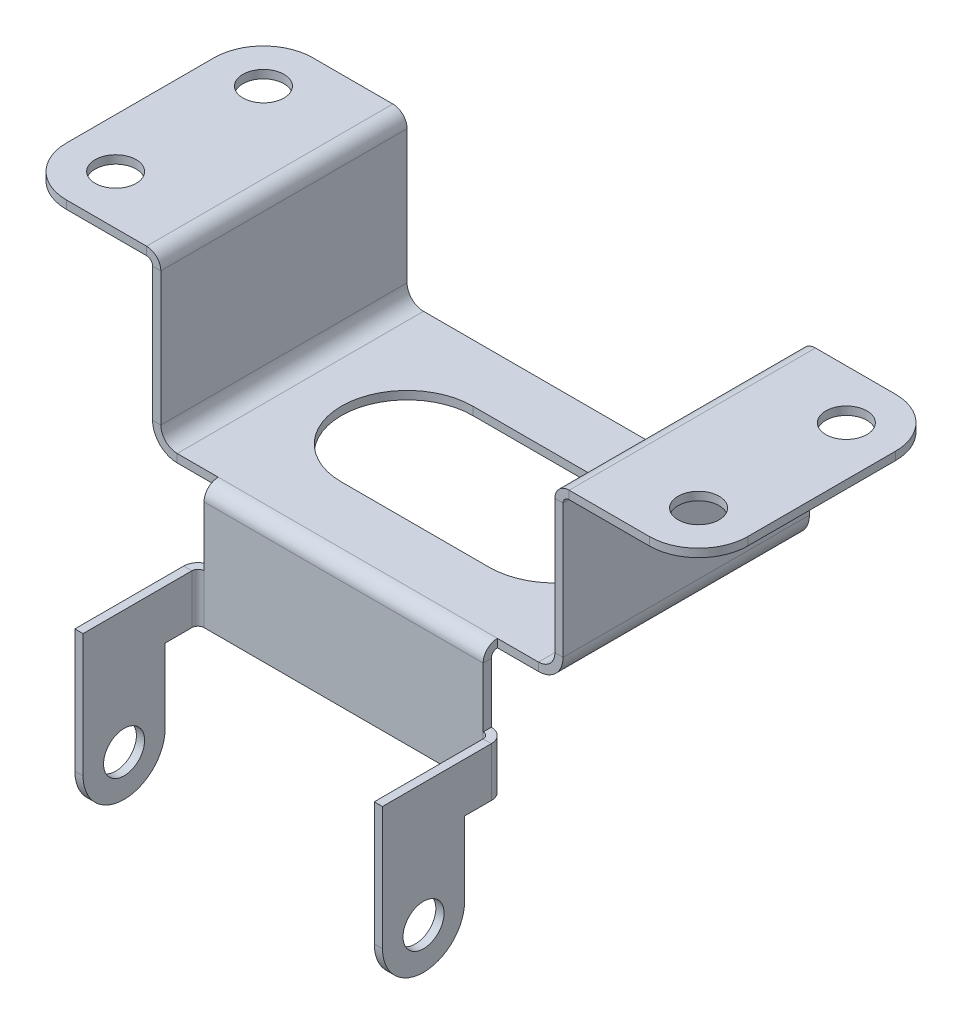
from build123d import *

# Parameters (mm, degrees)
SKETCH1_W                      = 50
SKETCH1_H                      = 30
BASE_FLANGE1_DEPTH             = 1
EDGE_FLANGE1_STRIP_W           = 8
EDGE_FLANGE1_STRIP_H           = 1
EDGE_FLANGE1_STRIP_CUT_DEPTH   = 30
EDGE_FLANGE1_STRIP_2_W         = 8
EDGE_FLANGE1_STRIP_2_H         = 1
EDGE_FLANGE1_STRIP_CUT_2_DEPTH = 30
EDGE_FLANGE1_DEPTH             = 30
EDGE_FLANGE1_BEND_DEPTH        = 30
EDGE_FLANGE2_STRIP_W           = 5.4732
EDGE_FLANGE2_STRIP_H           = 1
EDGE_FLANGE2_STRIP_CUT_DEPTH   = 30
EDGE_FLANGE2_STRIP_2_W         = 5.4732
EDGE_FLANGE2_STRIP_2_H         = 1
EDGE_FLANGE2_STRIP_CUT_2_DEPTH = 30
EDGE_FLANGE2_DEPTH             = 30
EDGE_FLANGE2_BEND_DEPTH        = 30
BREAK_CORNER1_START            = 20
BREAK_CORNER1_DEPTH            = 1
CUT_EXTRUDE1_DEPTH             = 10
SKETCH25_R                     = 2.5
CUT_EXTRUDE2_DEPTH             = 10
EDGE_FLANGE3_DEPTH             = 34
EDGE_FLANGE4_DEPTH             = 6
EDGE_FLANGE4_START             = -1
EDGE_FLANGE4_PROFILE_R         = 2.5
EDGE_FLANGE4_FLAT_DEPTH        = 1


# Read off the part's stored shape, not the designer's step: Break-Corner1
# Sheet-metal steps are written as plain solids
with BuildPart() as part:
    # Sketch1 → Base-Flange1 (new body)
    with BuildSketch(Plane(origin=(0, 0, 0), x_dir=(1, 0, 0), z_dir=(0, 1, 0))):
        Rectangle(SKETCH1_W, SKETCH1_H)
    extrude(amount=BASE_FLANGE1_DEPTH)

    # Edge-Flange1 strip (across the edge) → Edge-Flange1 strip cut (cut)
    with BuildSketch(Plane(origin=(25, 1, 15), x_dir=(-1, 0, 0), z_dir=(0, 0, -1))):
        with Locations((-1, -0.5)):
            Rectangle(EDGE_FLANGE1_STRIP_W, EDGE_FLANGE1_STRIP_H)
    extrude(amount=EDGE_FLANGE1_STRIP_CUT_DEPTH, mode=Mode.SUBTRACT)

    # Edge-Flange1 strip 2 (across the edge) → Edge-Flange1 strip cut 2 (cut)
    with BuildSketch(Plane(origin=(-25, 1, -15), x_dir=(1, 0, 0), z_dir=(0, 0, 1))):
        with Locations((-1, -0.5)):
            Rectangle(EDGE_FLANGE1_STRIP_2_W, EDGE_FLANGE1_STRIP_2_H)
    extrude(amount=EDGE_FLANGE1_STRIP_CUT_2_DEPTH, mode=Mode.SUBTRACT)

    # Edge-Flange1 section (across the edge) → Edge-Flange1 (add)
    with BuildSketch(Plane(origin=(25, 1, 15), x_dir=(-1, 0, 0), z_dir=(0, 0, -1))):
        with BuildLine():
            Line((0, 2), (0, 19))
            Line((0, 19), (1, 19))
            Line((1, 19), (1, 2))
            ThreePointArc((1, 2), (1.585786438, 0.585786438), (3, 0))
            Line((3, 0), (3, -1))
            ThreePointArc((3, -1), (0.878679656, -0.121320344), (0, 2))
        make_face()
    extrude(amount=EDGE_FLANGE1_DEPTH)

    # Edge-Flange1 section 2 (across the edge) → Edge-Flange1 bend (add)
    with BuildSketch(Plane(origin=(-25, 1, -15), x_dir=(1, 0, 0), z_dir=(0, 0, 1))):
        with BuildLine():
            Line((0, 2), (0, 19))
            Line((0, 19), (1, 19))
            Line((1, 19), (1, 2))
            ThreePointArc((1, 2), (1.585786438, 0.585786438), (3, 0))
            Line((3, 0), (3, -1))
            ThreePointArc((3, -1), (0.878679656, -0.121320344), (0, 2))
        make_face()
    extrude(amount=EDGE_FLANGE1_BEND_DEPTH)

    # Edge-Flange2 strip (across the edge) → Edge-Flange2 strip cut (cut)
    with BuildSketch(Plane(origin=(25, 20, -15), x_dir=(0, -1, 0), z_dir=(0, 0, 1))):
        with Locations((-2, -0.5)):
            Rectangle(EDGE_FLANGE2_STRIP_W, EDGE_FLANGE2_STRIP_H)
    extrude(amount=EDGE_FLANGE2_STRIP_CUT_DEPTH, mode=Mode.SUBTRACT)

    # Edge-Flange2 strip 2 (across the edge) → Edge-Flange2 strip cut 2 (cut)
    with BuildSketch(Plane(origin=(-25, 20, 15), x_dir=(0, -1, 0), z_dir=(0, 0, -1))):
        with Locations((-2, -0.5)):
            Rectangle(EDGE_FLANGE2_STRIP_2_W, EDGE_FLANGE2_STRIP_2_H)
    extrude(amount=EDGE_FLANGE2_STRIP_CUT_2_DEPTH, mode=Mode.SUBTRACT)

    # Edge-Flange2 section (across the edge) → Edge-Flange2 (add)
    with BuildSketch(Plane(origin=(25, 20, -15), x_dir=(0, -1, 0), z_dir=(0, 0, 1))):
        with BuildLine():
            Line((-1, 0.7366), (-1, 16.5))
            Line((-1, 16.5), (0, 16.5))
            Line((0, 16.5), (0, 0.7366))
            ThreePointArc((0, 0.7366), (0.215745145, 0.215745145), (0.7366, 0))
            Line((0.7366, 0), (0.7366, -1))
            ThreePointArc((0.7366, -1), (-0.491361636, -0.491361636), (-1, 0.7366))
        make_face()
    extrude(amount=EDGE_FLANGE2_DEPTH)

    # Edge-Flange2 section 2 (across the edge) → Edge-Flange2 bend (add)
    with BuildSketch(Plane(origin=(-25, 20, 15), x_dir=(0, -1, 0), z_dir=(0, 0, -1))):
        with BuildLine():
            Line((-1, 0.7366), (-1, 16.5))
            Line((-1, 16.5), (0, 16.5))
            Line((0, 16.5), (0, 0.7366))
            ThreePointArc((0, 0.7366), (0.215745145, 0.215745145), (0.7366, 0))
            Line((0.7366, 0), (0.7366, -1))
            ThreePointArc((0.7366, -1), (-0.491361636, -0.491361636), (-1, 0.7366))
        make_face()
    extrude(amount=EDGE_FLANGE2_BEND_DEPTH)

    # Break-Corner1 outline → Break-Corner1 (cut)
    with BuildSketch(Plane(origin=(0, 0, 0), x_dir=(1, 0, 0), z_dir=(0, 1, 0)).offset(BREAK_CORNER1_START)):
        with BuildLine():
            Line((41.5, -15), (41.5, -9))
            ThreePointArc((41.5, -9), (39.742640687, -13.242640687), (35.5, -15))
            Line((35.5, -15), (41.5, -15))
        make_face()
        with BuildLine():
            ThreePointArc((35.5, 15), (39.742640687, 13.242640687), (41.5, 9))
            Line((41.5, 9), (41.5, 15))
            Line((41.5, 15), (35.5, 15))
        make_face()
        with BuildLine():
            Line((-41.5, -15), (-35.5, -15))
            ThreePointArc((-35.5, -15), (-39.742640687, -13.242640687), (-41.5, -9))
            Line((-41.5, -9), (-41.5, -15))
        make_face()
        with BuildLine():
            Line((-41.5, 15), (-41.5, 9))
            ThreePointArc((-41.5, 9), (-39.742640687, 13.242640687), (-35.5, 15))
            Line((-35.5, 15), (-41.5, 15))
        make_face()
    extrude(amount=BREAK_CORNER1_DEPTH, mode=Mode.SUBTRACT)

    # Sketch24 → Cut-Extrude1 (cut)
    with BuildSketch(Plane(origin=(0, 1, 0), x_dir=(1, 0, 0), z_dir=(0, 1, 0))):
        with BuildLine():
            Line((-9, 8), (9, 8))
            ThreePointArc((9, 8), (17, 0), (9, -8))
            Line((9, -8), (-9, -8))
            ThreePointArc((-9, -8), (-17, 0), (-9, 8))
        make_face()
    extrude(amount=-CUT_EXTRUDE1_DEPTH, mode=Mode.SUBTRACT)

    # Sketch25 → Cut-Extrude2 (cut)
    with BuildSketch(Plane(origin=(0, 21, 0), x_dir=(1, 0, 0), z_dir=(0, 1, 0))):
        with Locations(Location((-35.5, 9, 0), (0, 0, 270))):
            Circle(SKETCH25_R)
        with Locations(Location((-35.5, -9, 0), (0, 0, 270))):
            Circle(SKETCH25_R)
    cut_extrude2 = extrude(amount=-CUT_EXTRUDE2_DEPTH, mode=Mode.SUBTRACT)

    # Mirror1: Cut-Extrude2 across plane
    add(cut_extrude2.mirror(Plane(origin=(0, 0, 0), x_dir=(0, 0, 1), z_dir=(1, 0, 0))), mode=Mode.SUBTRACT)

    # Edge-Flange3 section (across the edge) → Edge-Flange3 (add)
    with BuildSketch(Plane(origin=(17, 0, 15.7366), x_dir=(0, 0, -1), z_dir=(-1, 0, 0))):
        with BuildLine():
            Line((-1, 0.7366), (-1, 14))
            Line((-1, 14), (0, 14))
            Line((0, 14), (0, 0.7366))
            ThreePointArc((0, 0.7366), (0.215745145, 0.215745145), (0.7366, 0))
            Line((0.7366, 0), (0.7366, -1))
            ThreePointArc((0.7366, -1), (-0.491361636, -0.491361636), (-1, 0.7366))
        make_face()
    extrude(amount=EDGE_FLANGE3_DEPTH)

    # Edge-Flange4 bend section (across the edge) → Edge-Flange4 (add)
    with BuildSketch(Plane(origin=(-17.7366, -8, 16.7366), x_dir=(1, 0, 0), z_dir=(0, -1, 0))):
        with BuildLine():
            Line((-1, 0.7366), (0, 0.7366))
            ThreePointArc((0, 0.7366), (0.215745145, 0.215745145), (0.7366, 0))
            Line((0.7366, 0), (0.7366, -1))
            ThreePointArc((0.7366, -1), (-0.491361636, -0.491361636), (-1, 0.7366))
        make_face()
    edge_flange4 = extrude(amount=EDGE_FLANGE4_DEPTH)

    # Edge-Flange4 profile (on flange) → Edge-Flange4 flat (add)
    with BuildSketch(Plane(origin=(-17.7366, 0, 16.7366), x_dir=(0, 1, 0), z_dir=(1, 0, 0)).offset(EDGE_FLANGE4_START)):
        with BuildLine():
            ThreePointArc((-23, 14), (-28, 9), (-23, 4))
            Line((-23, 4), (-14, 4))
            Line((-14, 4), (-14, 0.7366))
            Line((-14, 0.7366), (-8, 0.7366))
            Line((-8, 0.7366), (-8, 14))
            Line((-8, 14), (-14, 14))
            Line((-14, 14), (-23, 14))
        make_face()
        with Locations((-23, 9)):
            Circle(EDGE_FLANGE4_PROFILE_R, mode=Mode.SUBTRACT)
    edge_flange4_flat = extrude(amount=EDGE_FLANGE4_FLAT_DEPTH)

    # Mirror2: Edge-Flange4, Edge-Flange4 flat across plane
    add(edge_flange4.mirror(Plane(origin=(0, 0, 0), x_dir=(0, 0, 1), z_dir=(1, 0, 0))))
    add(edge_flange4_flat.mirror(Plane(origin=(0, 0, 0), x_dir=(0, 0, 1), z_dir=(1, 0, 0))))


solid = part.part
